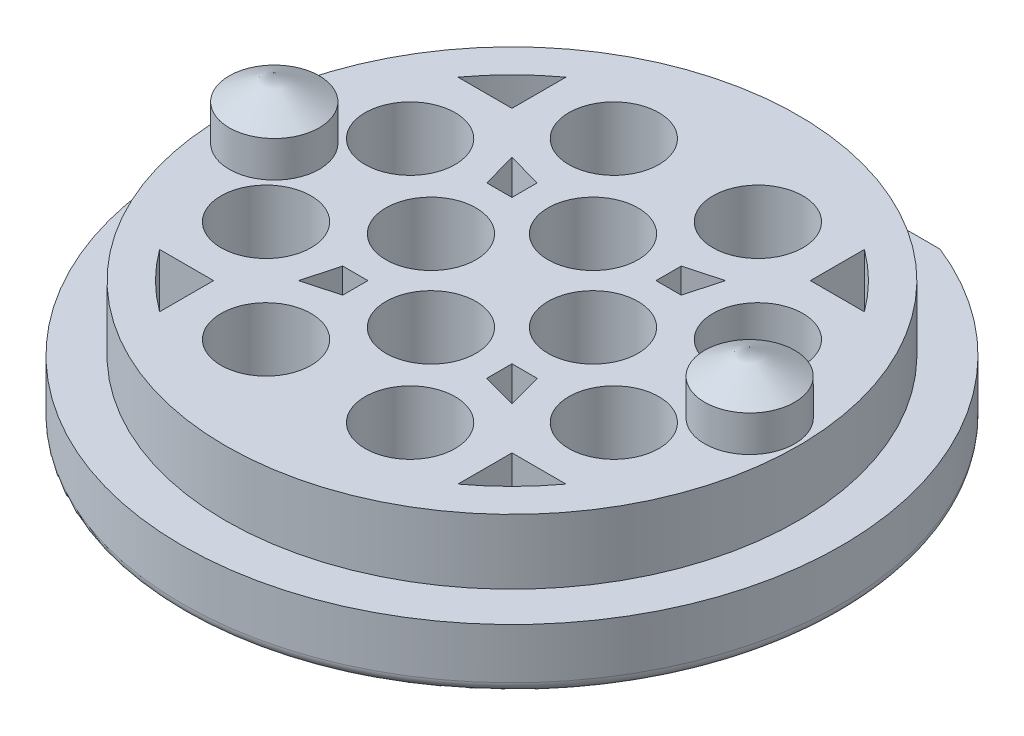
from build123d import *

# Parameters (mm, degrees)
BOSS_EXTRUDE1_DEPTH      = 1.4
BOSS_EXTRUDE1_DEPTH_BACK = 0.3
SKETCH1_R                = 9.15
SKETCH2_R                = 8.25
CUT_EXTRUDE1_DEPTH       = 14
SKETCH3_R                = 7.95
BOSS_EXTRUDE2_DEPTH      = 1.8
SKETCH4_R                = 1.25
CUT_EXTRUDE2_DEPTH       = 14.405036367
SKETCH6_R                = 1.25
BOSS_EXTRUDE3_DEPTH      = 1
FILLET1_R                = 0.3
CUT_EXTRUDE6_START       = 0.7
SKETCH9_W                = 11.458380674
SKETCH9_H                = 2.677452805
CUT_EXTRUDE6_DEPTH       = 2
CROQUIS1_R               = 8.25
SALIENTE_EXTRUIR1_DEPTH  = 0.1


with BuildPart() as part:
    # Sketch1 → Boss-Extrude1 (new, two sides: drawn at the far end of the back side and taken through both)
    with BuildSketch(Plane(origin=(0, 0, 0), x_dir=(1, 0, 0), z_dir=(0, 1, 0)).offset(-BOSS_EXTRUDE1_DEPTH_BACK)):
        with Locations(Location((0, 0, 0), (0, 0, 270))):
            Circle(SKETCH1_R)
    extrude(amount=BOSS_EXTRUDE1_DEPTH + BOSS_EXTRUDE1_DEPTH_BACK)

    # Sketch2 → Cut-Extrude1 (cut)
    with BuildSketch(Plane(origin=(0, 0, 0), x_dir=(1, 0, 0), z_dir=(0, 1, 0))):
        with Locations(Location((0, 0, 0), (0, 0, 270))):
            Circle(SKETCH2_R)
    extrude(amount=-CUT_EXTRUDE1_DEPTH, mode=Mode.SUBTRACT)

    # Sketch3 → Boss-Extrude2 (add)
    with BuildSketch(Plane(origin=(0, 1.4, 0), x_dir=(1, 0, 0), z_dir=(0, 1, 0))):
        with Locations(Location((0, 0, 0), (0, 0, 270))):
            Circle(SKETCH3_R)
    extrude(amount=BOSS_EXTRUDE2_DEPTH)

    # Sketch4 → Cut-Extrude2 (cut, through all)
    with BuildSketch(Plane(origin=(0, 3.2, 0), x_dir=(1, 0, 0), z_dir=(0, 1, 0))):
        with Locations(Location((-2.25, 0, 0), (0, 0, 270))):
            Circle(SKETCH4_R)
        with Locations(Location((0, 2.25, 0), (0, 0, 270))):
            Circle(SKETCH4_R)
        with Locations(Location((-2, 4.828427125, 0), (0, 0, 270))):
            Circle(SKETCH4_R)
        with Locations(Location((-4.828427125, 2, 0), (0, 0, 270))):
            Circle(SKETCH4_R)
        with Locations(Location((4.828427125, 2, 0), (0, 0, 270))):
            Circle(SKETCH4_R)
        with Locations(Location((2, 4.828427125, 0), (0, 0, 270))):
            Circle(SKETCH4_R)
        with Locations(Location((2.25, 0, 0), (0, 0, 270))):
            Circle(SKETCH4_R)
        with Locations(Location((2, -4.828427125, 0), (0, 0, 270))):
            Circle(SKETCH4_R)
        with Locations(Location((4.828427125, -2, 0), (0, 0, 270))):
            Circle(SKETCH4_R)
        with Locations(Location((-4.828427125, -2, 0), (0, 0, 270))):
            Circle(SKETCH4_R)
        with Locations(Location((-2, -4.828427125, 0), (0, 0, 270))):
            Circle(SKETCH4_R)
        with Locations(Location((0, -2.25, 0), (0, 0, 270))):
            Circle(SKETCH4_R)
        with BuildLine():
            Line((-5.642596448, 4.142596448), (-4.142596448, 4.142596448))
            Line((-4.142596448, 4.142596448), (-4.142596448, 5.642596448))
            ThreePointArc((-4.142596448, 5.642596448), (-4.949747468, 4.949747468), (-5.642596448, 4.142596448))
        make_face()
        Polygon((-2.7, 2), (-2, 2), (-2, 2.7), (-2.964410286, 2.964410286), align=None)
        Polygon((2.964410286, 2.964410286), (2.7, 2), (2, 2), (2, 2.7), align=None)
        with BuildLine():
            Line((4.142596448, 5.642596448), (4.142596448, 4.142596448))
            Line((4.142596448, 4.142596448), (5.642596448, 4.142596448))
            ThreePointArc((5.642596448, 4.142596448), (4.949747468, 4.949747468), (4.142596448, 5.642596448))
        make_face()
        with BuildLine():
            Line((5.642596448, -4.142596448), (4.142596448, -4.142596448))
            Line((4.142596448, -4.142596448), (4.142596448, -5.642596448))
            ThreePointArc((4.142596448, -5.642596448), (4.949747468, -4.949747468), (5.642596448, -4.142596448))
        make_face()
        Polygon((2.7, -2), (2, -2), (2, -2.7), (2.964410286, -2.964410286), align=None)
        Polygon((-2.964410286, -2.964410286), (-2.7, -2), (-2, -2), (-2, -2.7), align=None)
        with BuildLine():
            Line((-4.142596448, -5.642596448), (-4.142596448, -4.142596448))
            Line((-4.142596448, -4.142596448), (-5.642596448, -4.142596448))
            ThreePointArc((-5.642596448, -4.142596448), (-4.949747468, -4.949747468), (-4.142596448, -5.642596448))
        make_face()
    extrude(amount=-CUT_EXTRUDE2_DEPTH, mode=Mode.SUBTRACT)

    # Sketch6 → Boss-Extrude3 (add)
    with BuildSketch(Plane(origin=(0, 3.2, 0), x_dir=(1, 0, 0), z_dir=(0, 1, 0))):
        with Locations(Location((-6.6, 0, 0), (0, 0, 270))):
            Circle(SKETCH6_R)
        with Locations(Location((6.6, 0, 0), (0, 0, 270))):
            Circle(SKETCH6_R)
    extrude(amount=BOSS_EXTRUDE3_DEPTH)

    # Sketch7 → Revolve1 (revolve)
    with BuildSketch(Plane.XY, mode=Mode.PRIVATE) as revolve1_sk:
        Polygon((-7.85, 4.2), (-6.6, 4.2), (-6.6, 4.9), align=None)
    revolve(revolve1_sk.sketch.rotate(Axis((-6.6, 4.2, 0), (0, 1, 0)), 270), axis=Axis((-6.6, 4.2, 0), (0, 1, 0)))

    # Sketch8 → Revolve2 (revolve)
    with BuildSketch(Plane.XY, mode=Mode.PRIVATE) as revolve2_sk:
        Polygon((7.85, 4.2), (6.6, 4.2), (6.6, 4.9), align=None)
    revolve(revolve2_sk.sketch.rotate(Axis((6.6, 4.2, 0), (0, 1, 0)), 90), axis=Axis((6.6, 4.2, 0), (0, 1, 0)))

    # Fillet1
    fillet1_edges = [part.edges().sort_by_distance(p)[0] for p in [
        (0, -0.3, -9.15),
    ]]
    fillet(fillet1_edges, radius=FILLET1_R - 0.0001)  # a hair under: the kernel refuses the full size

    # Sketch9 → Cut-Extrude6 (cut)
    with BuildSketch(Plane(origin=(0, 0, 0), x_dir=(1, 0, 0), z_dir=(0, 1, 0)).offset(CUT_EXTRUDE6_START)):
        with Locations((0, 9.838726403)):
            Rectangle(SKETCH9_W, SKETCH9_H)
    extrude(amount=CUT_EXTRUDE6_DEPTH, mode=Mode.SUBTRACT)

    # Croquis1 → Saliente-Extruir1 (add)
    with BuildSketch(Plane.XZ):
        with Locations(Location((0, 0, 0), (0, 0, 90))):
            Circle(CROQUIS1_R)
    extrude(amount=SALIENTE_EXTRUIR1_DEPTH)


solid = part.part
